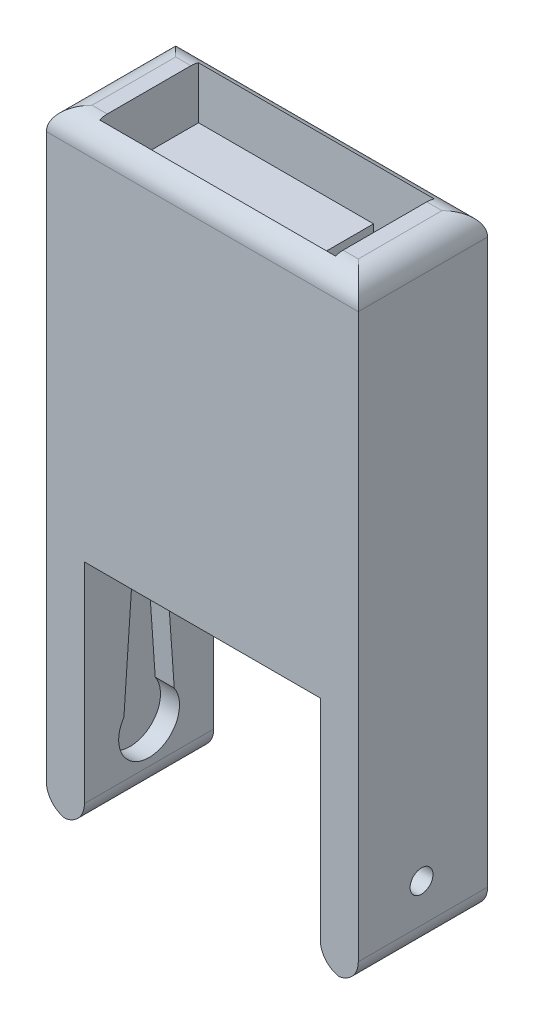
from build123d import *

# Parameters (mm, degrees)
SKETCH1_W             = 5
SKETCH1_H             = 17
BOSS_EXTRUDE1_DEPTH   = 80
BOSS_EXTRUDE1_2_DEPTH = 80
CUT_EXTRUDE1_DEPTH    = 2.5
BOSS_EXTRUDE2_REACH   = 91.359
SKETCH5_W             = 3
SKETCH5_H             = 13
CUT_EXTRUDE2_DEPTH    = 5
FILLET1_R             = 3
FILLET2_R             = 3
SKETCH6_R             = 1.5
CUT_EXTRUDE3_DEPTH    = 90.358827208
BOSS_EXTRUDE3_REACH   = 91.359
SKETCH7_W             = 17
SKETCH7_H             = 37.482200285


with BuildPart() as part:
    # Sketch1 → Boss-Extrude1 (new body)
    with BuildSketch(Plane(origin=(0, 0, 0), x_dir=(1, 0, 0), z_dir=(0, 1, 0))):
        with Locations((2.5, -8.5)):
            Rectangle(SKETCH1_W, SKETCH1_H)
    extrude(amount=BOSS_EXTRUDE1_DEPTH)

    # Sketch2 → Cut-Extrude1 (cut)
    with BuildSketch(Plane(origin=(5, 0, 0), x_dir=(0, 0, -1), z_dir=(1, 0, 0))):
        with BuildLine():
            Line((-10.75, 25.267799715), (-11.807189139, 10.25))
            ThreePointArc((-11.807189139, 10.25), (-8.5, 12), (-5.192810861, 10.25))
            Line((-5.192810861, 10.25), (-6.25, 25.267799715))
            ThreePointArc((-6.25, 25.267799715), (-8.5, 27.517799715), (-10.75, 25.267799715))
        make_face()
        with BuildLine():
            ThreePointArc((-5.192810861, 10.25), (-8.5, 12), (-11.807189139, 10.25))
            Line((-11.807189139, 10.25), (-11.807189139, 5.75))
            ThreePointArc((-11.807189139, 5.75), (-8.5, 4), (-5.192810861, 5.75))
            Line((-5.192810861, 5.75), (-5.192810861, 10.25))
        make_face()
        with BuildLine():
            Line((-11.807189139, 5.75), (-11.807189139, 10.25))
            ThreePointArc((-11.807189139, 10.25), (-12.5, 8), (-11.807189139, 5.75))
        make_face()
        with BuildLine():
            ThreePointArc((-4.5, 8), (-4.677124344, 9.177124344), (-5.192810861, 10.25))
            Line((-5.192810861, 10.25), (-5.192810861, 5.75))
            ThreePointArc((-5.192810861, 5.75), (-4.677124344, 6.822875656), (-4.5, 8))
        make_face()
    extrude(amount=-CUT_EXTRUDE1_DEPTH, mode=Mode.SUBTRACT)


with BuildPart() as body_2:
    # Sketch1 → Boss-Extrude1 2 (new body)
    with BuildSketch(Plane(origin=(0, 0, 0), x_dir=(1, 0, 0), z_dir=(0, 1, 0))):
        with Locations((38.5, -8.5)):
            Rectangle(SKETCH1_W, SKETCH1_H)
    extrude(amount=BOSS_EXTRUDE1_2_DEPTH)


    # Sketch4 → Boss-Extrude2 (add, up to next)
    with BuildSketch(Plane.ZY.offset(-36), mode=Mode.PRIVATE) as boss_extrude2_sk1:
        Polygon((2, 73), (15, 73), (15, 80), (17, 80), (17, 72), (17, 68), (0, 68), (0, 72), (0, 80), (2, 80), align=None)
    boss_extrude2_tool1 = extrude(boss_extrude2_sk1.sketch, amount=BOSS_EXTRUDE2_REACH, mode=Mode.PRIVATE) - part.part
    add(boss_extrude2_tool1.solids().sort_by_distance((36, 71.986726, 8.5))[0])

    # Sketch5 → Cut-Extrude2 (cut)
    with BuildSketch(Plane(origin=(0, 73, 0), x_dir=(1, 0, 0), z_dir=(0, 1, 0))):
        with Locations((29.5, -8.5)):
            Rectangle(SKETCH5_W, SKETCH5_H)
    extrude(amount=-CUT_EXTRUDE2_DEPTH, mode=Mode.SUBTRACT)

    # Fillet1
    # the kernel refuses this fillet: 3 mm, written as the material it takes off along each edge
    with BuildSketch(Plane(origin=(36, 0, 24.5), x_dir=(0, 1, 0), z_dir=(0, 0, -1)), Plane(origin=(41, 0, -7.5), x_dir=(0, 1, 0), z_dir=(0, 0, 1)), Plane(origin=(41, 80, -7.5), x_dir=(-1, 0, 0), z_dir=(0, 0, 1))) as fillet1_piece_1:
        with BuildLine():
            CenterArc((FILLET1_R, FILLET1_R), FILLET1_R, 180, 90)
            Line((0, FILLET1_R), (0, 0))
            Line((0, 0), (FILLET1_R, 0))
        make_face()
    extrude(amount=32, mode=Mode.SUBTRACT)
    with BuildSketch(Plane(origin=(-2.5, 80, 17), x_dir=(0, 0, -1), z_dir=(1, 0, 0)), Plane(origin=(48.5, 80, 0), x_dir=(0, 0, 1), z_dir=(-1, 0, 0))) as fillet1_piece_2:
        with BuildLine():
            CenterArc((FILLET1_R, -FILLET1_R), FILLET1_R, 90, 90)
            Line((0, -FILLET1_R), (0, 0))
            Line((0, 0), (FILLET1_R, 0))
        make_face()
    extrude(amount=51, mode=Mode.SUBTRACT)

    # Sketch6 → Cut-Extrude3 (cut, through all)
    with BuildSketch(Plane.ZY.offset(-36)):
        with Locations((8.686376561, 8.041960108)):
            Circle(SKETCH6_R)
    extrude(amount=-CUT_EXTRUDE3_DEPTH, mode=Mode.SUBTRACT)

    # Sketch7 → Boss-Extrude3 (add, up to next)
    with BuildSketch(Plane(origin=(5, 0, 0), x_dir=(0, 0, -1), z_dir=(1, 0, 0)), mode=Mode.PRIVATE) as boss_extrude3_sk1:
        with Locations((-8.5, 49.258899857)):
            Rectangle(SKETCH7_W, SKETCH7_H)
    boss_extrude3_tool1 = extrude(boss_extrude3_sk1.sketch, amount=BOSS_EXTRUDE3_REACH, mode=Mode.PRIVATE) - body_2.part


with BuildPart() as part_1:
    add(part.part)

    # Fillet2
    # the kernel refuses this fillet: 3 mm, written as the material it takes off along each edge
    with BuildSketch(Plane(origin=(0, 0, 24.5), x_dir=(0, 1, 0), z_dir=(0, 0, -1)), Plane(origin=(5, 0, -7.5), x_dir=(0, 1, 0), z_dir=(0, 0, 1))) as fillet2_piece_1:
        with BuildLine():
            CenterArc((FILLET2_R, FILLET2_R), FILLET2_R, 180, 90)
            Line((0, FILLET2_R), (0, 0))
            Line((0, 0), (FILLET2_R, 0))
        make_face()
    extrude(amount=32, mode=Mode.SUBTRACT)
    with BuildSketch(Plane(origin=(12.5, 80, 17), x_dir=(0, 0, -1), z_dir=(-1, 0, 0))) as fillet2_piece_2:
        with BuildLine():
            CenterArc((FILLET2_R, FILLET2_R), FILLET2_R, 180, 90)
            Line((0, FILLET2_R), (0, 0))
            Line((0, 0), (FILLET2_R, 0))
        make_face()
    extrude(amount=20, mode=Mode.SUBTRACT)
    with BuildSketch(Plane(origin=(0, 80, 24.5), x_dir=(0, -1, 0), z_dir=(0, 0, -1))) as fillet2_piece_3:
        with BuildLine():
            CenterArc((FILLET2_R, -FILLET2_R), FILLET2_R, 90, 90)
            Line((0, -FILLET2_R), (0, 0))
            Line((0, 0), (FILLET2_R, 0))
        make_face()
    extrude(amount=32, mode=Mode.SUBTRACT)
    with BuildSketch(Plane(origin=(-7.5, 80, 0), x_dir=(0, -1, 0), z_dir=(1, 0, 0))) as fillet2_piece_4:
        with BuildLine():
            CenterArc((FILLET2_R, -FILLET2_R), FILLET2_R, 90, 90)
            Line((0, -FILLET2_R), (0, 0))
            Line((0, 0), (FILLET2_R, 0))
        make_face()
    extrude(amount=20, mode=Mode.SUBTRACT)


with BuildPart() as body_2_1:
    add(body_2.part)

    add(part_1.part)  # Boss-Extrude3 merges part
    add(boss_extrude3_tool1.solids().sort_by_distance((5, 49.2589, 8.5))[0])


solid = body_2_1.part
